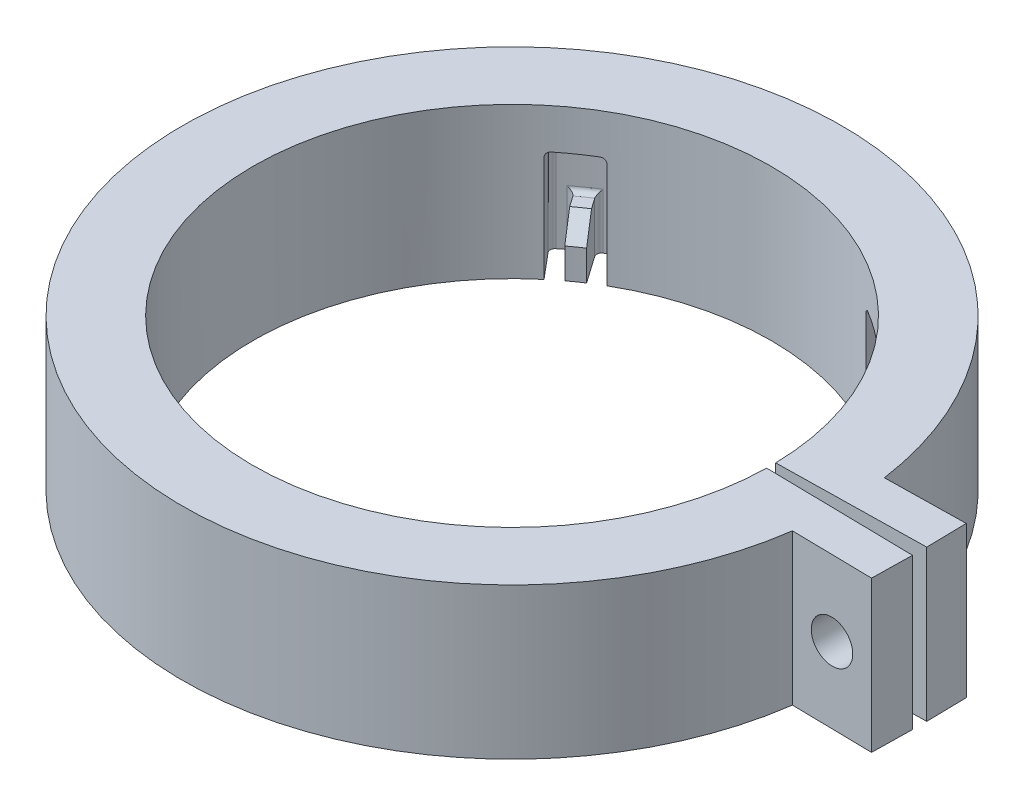
from build123d import *

# Parameters (mm, degrees)
BOSS_EXTRUDE1_DEPTH = 7.5
SKETCH2_R           = 1.05
CUT_EXTRUDE1_DEPTH  = 2
SKETCH3_R           = 1.05
CUT_EXTRUDE2_DEPTH  = 2
SKETCH4_W           = 5.25
SKETCH4_H           = 0.5
CUT_EXTRUDE3_DEPTH  = 5.5
BOSS_EXTRUDE2_DEPTH = 2.5
FILLET1_R           = 0.25
CHAMFER1_SIZE       = 1


with BuildPart() as part:
    # Sketch1 → Boss-Extrude1 (new body)
    with BuildSketch(Plane(origin=(0, 0, 0), x_dir=(1, 0, 0), z_dir=(0, 1, 0))):
        with BuildLine():
            Line((16.215023536, 2.283338945), (20.214414316, 2.35314857))
            Line((20.214414316, 2.35314857), (20.249319129, 0.35345318))
            Line((20.249319129, 0.35345318), (16.372506008, 0.285783155))
            Line((16.372506008, 0.285783155), (12.873039075, 0.224699733))
            ThreePointArc((12.873039075, 0.224699733), (-12.875, 0), (12.873039075, -0.224699733))
            Line((12.873039075, -0.224699733), (16.372506008, -0.285783155))
            Line((16.372506008, -0.285783155), (20.249319129, -0.35345318))
            Line((20.249319129, -0.35345318), (20.214414316, -2.35314857))
            Line((20.214414316, -2.35314857), (16.215023536, -2.283338945))
            ThreePointArc((16.215023536, -2.283338945), (-16.375, 0), (16.215023536, 2.283338945))
        make_face()
    extrude(amount=BOSS_EXTRUDE1_DEPTH)

    # Sketch2 → Cut-Extrude1 (cut)
    with BuildSketch(Plane(origin=(-0.034904813, 0, 1.99969539), x_dir=(0.9998476951563915, 0, 0.01745240643727699), z_dir=(-0.01745240643727699, 0, 0.9998476951563915))):
        with Locations((18.252403668, 3.75)):
            Circle(SKETCH2_R)
    extrude(amount=-CUT_EXTRUDE1_DEPTH, mode=Mode.SUBTRACT)

    # Sketch3 → Cut-Extrude2 (cut)
    with BuildSketch(Plane(origin=(-0.034904813, 0, -1.99969539), x_dir=(-0.9998476951563915, 0, 0.01745240643727699), z_dir=(-0.01745240643727699, 0, -0.9998476951563915))):
        with Locations((-18.252403668, 3.75)):
            Circle(SKETCH3_R)
    extrude(amount=-CUT_EXTRUDE2_DEPTH, mode=Mode.SUBTRACT)

    # Sketch4 → Cut-Extrude3 (cut)
    with BuildSketch(Plane.XZ):
        with BuildLine():
            Line((-8.275890475, -9.862822205), (-9.497186933, -11.318306647))
            ThreePointArc((-9.497186933, -11.318306647), (-8.474591847, -12.102971454), (-7.3875, -12.795525341))
            Line((-7.3875, -12.795525341), (-6.4375, -11.150077074))
            ThreePointArc((-6.4375, -11.150077074), (-7.384796618, -10.54658257), (-8.275890475, -9.862822205))
        make_face()
        with BuildLine():
            Line((8.275890475, -9.862822205), (9.497186933, -11.318306647))
            ThreePointArc((9.497186933, -11.318306647), (8.474591847, -12.102971454), (7.3875, -12.795525341))
            Line((7.3875, -12.795525341), (6.4375, -11.150077074))
            ThreePointArc((6.4375, -11.150077074), (7.384796618, -10.54658257), (8.275890475, -9.862822205))
        make_face()
        with Locations((0, 12.854562666)):
            Rectangle(SKETCH4_W, SKETCH4_H)
    extrude(amount=-CUT_EXTRUDE3_DEPTH, mode=Mode.SUBTRACT)

    # Sketch5 → Boss-Extrude2 (add)
    with BuildSketch(Plane.XZ):
        with BuildLine():
            Line((8.152855692, -12.321995336), (7.062626355, -10.764986482))
            ThreePointArc((7.062626355, -10.764986482), (7.384796618, -10.54658257), (7.700217882, -10.318540089))
            Line((7.700217882, -10.318540089), (8.790447219, -11.875548943))
            ThreePointArc((8.790447219, -11.875548943), (8.474591847, -12.102971454), (8.152855692, -12.321995336))
        make_face()
        with BuildLine():
            Line((-8.790447219, -11.875548943), (-7.700217882, -10.318540089))
            ThreePointArc((-7.700217882, -10.318540089), (-7.384796618, -10.54658257), (-7.062626355, -10.764986482))
            Line((-7.062626355, -10.764986482), (-8.152855692, -12.321995336))
            ThreePointArc((-8.152855692, -12.321995336), (-8.474591847, -12.102971454), (-8.790447219, -11.875548943))
        make_face()
    extrude(amount=-BOSS_EXTRUDE2_DEPTH)

    # Fillet1
    # the kernel refuses this fillet: 0.25 mm, written as the material it adds along each edge
    with BuildSketch(Plane(origin=(0, 2.5, 0), x_dir=(0.62841176473142, 0, -0.777880873879248), z_dir=(0.777880873879248, 0, 0.62841176473142))) as fillet1_piece_1_section:
        with BuildLine():
            CenterArc((14.775 - FILLET1_R, FILLET1_R), FILLET1_R, 270, 90)
            Line((14.775 - FILLET1_R, 0), (14.775, 0))
            Line((14.775, 0), (14.775, FILLET1_R))
        make_face()
    fillet1_piece_1 = revolve(axis=Axis((0, 2.5, 0), (0, 1, 0)), revolution_arc=7.866084762, mode=Mode.PRIVATE)
    fillet1_piece_1 = split(fillet1_piece_1, bisect_by=Plane(origin=(8.759939705, 2.55659864, -11.831979697), z_dir=(-0.8191520442889932, 0, -0.573576436351044)), keep=Keep.TOP, mode=Mode.PRIVATE)
    fillet1_piece_1 = split(fillet1_piece_1, bisect_by=Plane(origin=(8.122348177, 2.55659864, -12.278426091), z_dir=(0.8191520442889957, 0, 0.5735764363510407)), keep=Keep.TOP, mode=Mode.PRIVATE)
    add(fillet1_piece_1)
    with BuildSketch(Plane(origin=(8.790447219, 0, -11.875548943), x_dir=(0.7984700606490586, 0, 0.6020345191491006), z_dir=(0, 1, 0)), Plane(origin=(-8.152855692, 0, -12.321995336), x_dir=(0.8388202396872455, 0, -0.5444084913840267), z_dir=(0, 1, 0))) as fillet1_piece_2:
        with BuildLine():
            CenterArc((0.258953447, -0.249990236), FILLET1_R, 89.493613217, 92.522135515)
            Line((0.009108148, -0.258783785), (0, 0))
            ThreePointArc((0, 0), (0.130581474, 0.000577051), (0.261162947, 0))
        make_face()
    extrude(amount=2.5)
    with BuildSketch(Plane(origin=(8.152855692, 0, -12.321995336), x_dir=(-0.8388202396872467, 0, -0.5444084913840251), z_dir=(0, 1, 0)), Plane(origin=(-8.790447219, 0, -11.875548943), x_dir=(-0.7984700606490618, 0, 0.6020345191490962), z_dir=(0, 1, 0))) as fillet1_piece_3:
        with BuildLine():
            CenterArc((0.258953447, 0.249990236), FILLET1_R, 177.984251268, 92.522135515)
            Line((0.009108148, 0.258783785), (0, 0))
            ThreePointArc((0, 0), (0.130581474, -0.000577051), (0.261162947, 0))
        make_face()
    extrude(amount=2.5)
    with BuildSketch(Plane(origin=(-2.625, 5.5, 11.979562666), x_dir=(0, -1, 0), z_dir=(0, 0, 1))) as fillet1_piece_4_section:
        with BuildLine():
            CenterArc((FILLET1_R, FILLET1_R), FILLET1_R, 180, 90)
            Line((0, FILLET1_R), (0, 0))
            Line((0, 0), (FILLET1_R, 0))
        make_face()
    fillet1_piece_4 = extrude(amount=1.75, mode=Mode.PRIVATE)
    fillet1_piece_4 = fillet1_piece_4 - Plane(origin=(0, 5.442690928, 0), x_dir=(0.9998476951563914, 0, -0.01745240643727672), z_dir=(0, -1, 0)) * Cylinder(12.875, 5, mode=Mode.PRIVATE)
    add(fillet1_piece_4)
    with BuildSketch(Plane(origin=(-2.625, 0, 13.104562666), x_dir=(1, 0, 0), z_dir=(0, 1, 0)), Plane(origin=(2.625, 0, 13.104562666), x_dir=(0, 0, -1), z_dir=(0, 1, 0))) as fillet1_piece_5:
        with BuildLine():
            CenterArc((FILLET1_R, FILLET1_R), FILLET1_R, 180, 90)
            Line((0, FILLET1_R), (0, 0))
            Line((0, 0), (FILLET1_R, 0))
        make_face()
    extrude(amount=6.125)
    with BuildSketch(Plane(origin=(2.625, 5.5, 13.729562666), x_dir=(0, -1, 0), z_dir=(0, 0, -1))) as fillet1_piece_6_section:
        with BuildLine():
            CenterArc((FILLET1_R, FILLET1_R), FILLET1_R, 180, 90)
            Line((0, FILLET1_R), (0, 0))
            Line((0, 0), (FILLET1_R, 0))
        make_face()
    fillet1_piece_6 = extrude(amount=1.75, mode=Mode.PRIVATE)
    fillet1_piece_6 = fillet1_piece_6 - Plane(origin=(0, 5.443401221, 0), x_dir=(0.9998476951563914, 0, -0.01745240643727672), z_dir=(0, -1, 0)) * Cylinder(12.875, 5, mode=Mode.PRIVATE)
    add(fillet1_piece_6)
    with BuildSketch(Plane(origin=(-7.7, 5.5, -13.336791218), x_dir=(0, -1, 0), z_dir=(0.4999999999999989, 0, 0.8660254037844394))) as fillet1_piece_7_section:
        with BuildLine():
            CenterArc((FILLET1_R, -FILLET1_R), FILLET1_R, 90, 90)
            Line((0, -FILLET1_R), (0, 0))
            Line((0, 0), (FILLET1_R, 0))
        make_face()
    fillet1_piece_7 = extrude(amount=3.15, mode=Mode.PRIVATE)
    fillet1_piece_7 = fillet1_piece_7 - Plane(origin=(0, 5.443414893, 0), x_dir=(0.9998476951563914, 0, -0.01745240643727672), z_dir=(0, -1, 0)) * Cylinder(12.875, 8, mode=Mode.PRIVATE)
    add(fillet1_piece_7)
    with BuildSketch(Plane(origin=(-7.3875, 0, -12.795525341), x_dir=(-0.8616902462472484, 0, 0.5074346455676397), z_dir=(0, 1, 0)), Plane(origin=(9.497186933, 0, -11.318306647), x_dir=(-0.7715480134948484, 0, -0.6361710955962662), z_dir=(0, 1, 0))) as fillet1_piece_8:
        with BuildLine():
            CenterArc((0.252160801, 0.249990742), FILLET1_R, 179.506896654, 90.986206692)
            Line((0.00217006, 0.252142284), (0, 0))
            ThreePointArc((0, 0), (0.127156172, -0.000547174), (0.254312344, 0))
        make_face()
    extrude(amount=6.13578086)
    with BuildSketch(Plane(origin=(-7.874148219, 5.5, -9.384044428), x_dir=(0, -1, 0), z_dir=(-0.6427876096865357, 0, -0.7660444431189812))) as fillet1_piece_9_section:
        with BuildLine():
            CenterArc((FILLET1_R, -FILLET1_R), FILLET1_R, 90, 90)
            Line((0, -FILLET1_R), (0, 0))
            Line((0, 0), (FILLET1_R, 0))
        make_face()
    fillet1_piece_9 = extrude(amount=3.15, mode=Mode.PRIVATE)
    fillet1_piece_9 = fillet1_piece_9 - Plane(origin=(0, 5.443401887, 0), x_dir=(0.9998476951563914, 0, -0.01745240643727672), z_dir=(0, -1, 0)) * Cylinder(12.875, 8, mode=Mode.PRIVATE)
    add(fillet1_piece_9)
    with BuildSketch(Plane(origin=(-9.497186933, 0, -11.318306647), x_dir=(0.6427876096865356, 0, 0.7660444431189811), z_dir=(0, 1, 0)), Plane(origin=(7.3875, 0, -12.795525341), x_dir=(-0.499999999999998, 0, 0.8660254037844396), z_dir=(0, 1, 0))) as fillet1_piece_10:
        with BuildLine():
            CenterArc((0.252151622, 0.25), FILLET1_R, 179.013793308, 90.986206692)
            ThreePointArc((0.002188655, 0.254302926), (0.000547174, 0.127156172), (0, 0))
            Line((0, 0), (0.252151622, 0))
        make_face()
    extrude(amount=6.13578086)
    with BuildSketch(Plane(origin=(7.874148219, 5.5, -9.384044428), x_dir=(0, -1, 0), z_dir=(0.6427876096865357, 0, -0.7660444431189812))) as fillet1_piece_11_section:
        with BuildLine():
            CenterArc((FILLET1_R, FILLET1_R), FILLET1_R, 180, 90)
            Line((0, FILLET1_R), (0, 0))
            Line((0, 0), (FILLET1_R, 0))
        make_face()
    fillet1_piece_11 = extrude(amount=3.15, mode=Mode.PRIVATE)
    fillet1_piece_11 = fillet1_piece_11 - Plane(origin=(0, 5.443401886, 0), x_dir=(0.9998476951563914, 0, -0.01745240643727672), z_dir=(0, -1, 0)) * Cylinder(12.875, 8, mode=Mode.PRIVATE)
    add(fillet1_piece_11)
    with BuildSketch(Plane(origin=(7.7, 5.5, -13.336791218), x_dir=(0, -1, 0), z_dir=(-0.4999999999999989, 0, 0.8660254037844394))) as fillet1_piece_12_section:
        with BuildLine():
            CenterArc((FILLET1_R, FILLET1_R), FILLET1_R, 180, 90)
            Line((0, FILLET1_R), (0, 0))
            Line((0, 0), (FILLET1_R, 0))
        make_face()
    fillet1_piece_12 = extrude(amount=3.15, mode=Mode.PRIVATE)
    fillet1_piece_12 = fillet1_piece_12 - Plane(origin=(0, 5.443414893, 0), x_dir=(0.9998476951563914, 0, -0.01745240643727672), z_dir=(0, -1, 0)) * Cylinder(12.875, 8, mode=Mode.PRIVATE)
    add(fillet1_piece_12)
    with BuildSketch(Plane(origin=(0, 2.5, 0), x_dir=(-0.5160394351938659, 0, -0.856564826107631), z_dir=(0.856564826107631, 0, -0.5160394351938659))) as fillet1_piece_13_section:
        with BuildLine():
            CenterArc((14.775 - FILLET1_R, FILLET1_R), FILLET1_R, 270, 90)
            Line((14.775 - FILLET1_R, 0), (14.775, 0))
            Line((14.775, 0), (14.775, FILLET1_R))
        make_face()
    fillet1_piece_13 = revolve(axis=Axis((0, 2.5, 0), (0, 1, 0)), revolution_arc=7.866084762, mode=Mode.PRIVATE)
    fillet1_piece_13 = split(fillet1_piece_13, bisect_by=Plane(origin=(-8.759939705, 2.55659864, -11.831979697), z_dir=(0.8191520442889937, 0, -0.5735764363510434)), keep=Keep.TOP, mode=Mode.PRIVATE)
    fillet1_piece_13 = split(fillet1_piece_13, bisect_by=Plane(origin=(-8.122348177, 2.55659864, -12.278426091), z_dir=(-0.8191520442889957, 0, 0.5735764363510407)), keep=Keep.TOP, mode=Mode.PRIVATE)
    add(fillet1_piece_13)
    with BuildSketch(Plane(origin=(8.790447219, 0, -11.875548943), x_dir=(0.7984700606490586, 0, 0.6020345191491006), z_dir=(0, 1, 0))) as fillet1_piece_14a_section:
        with BuildLine():
            CenterArc((0.258953447, -0.249990236), FILLET1_R, 89.493613217, 92.522135515)
            Line((0.009108148, -0.258783785), (0, 0))
            ThreePointArc((0, 0), (0.130581474, 0.000577051), (0.261162947, 0))
        make_face()
    fillet1_piece_14a = extrude(amount=3.152907368, mode=Mode.PRIVATE)
    fillet1_piece_14a = split(fillet1_piece_14a, bisect_by=Plane(origin=(8.804363414, 2.5, -11.791834309), z_dir=(0, 1, 0)), keep=Keep.TOP, mode=Mode.PRIVATE)
    with BuildSketch(Plane(origin=(0, 2.5, 0), x_dir=(0.62841176473142, 0, -0.777880873879248), z_dir=(0.777880873879248, 0, 0.62841176473142))) as fillet1_piece_14b_section:
        with BuildLine():
            CenterArc((14.775 - FILLET1_R, FILLET1_R), FILLET1_R, 270, 90)
            Line((14.775 - FILLET1_R, 0), (14.775, 0))
            Line((14.775, 0), (14.775, FILLET1_R))
        make_face()
    fillet1_piece_14b = revolve(axis=Axis((0, 2.5, 0), (0, 1, 0)), revolution_arc=7.866084762, mode=Mode.PRIVATE)
    fillet1_piece_14b = split(fillet1_piece_14b, bisect_by=Plane(origin=(8.750942177, 2.556788389, -11.819129896), z_dir=(0.8191520442889932, 0, 0.573576436351044)), keep=Keep.TOP, mode=Mode.PRIVATE)
    fillet1_piece_14 = fillet1_piece_14a & fillet1_piece_14b
    add(fillet1_piece_14)
    with BuildSketch(Plane(origin=(0, 2.5, 0), x_dir=(0.62841176473142, 0, -0.777880873879248), z_dir=(0.777880873879248, 0, 0.62841176473142))) as fillet1_piece_15a_section:
        with BuildLine():
            CenterArc((14.775 - FILLET1_R, FILLET1_R), FILLET1_R, 270, 90)
            Line((14.775 - FILLET1_R, 0), (14.775, 0))
            Line((14.775, 0), (14.775, FILLET1_R))
        make_face()
    fillet1_piece_15a = revolve(axis=Axis((0, 2.5, 0), (0, 1, 0)), revolution_arc=7.866084762, mode=Mode.PRIVATE)
    fillet1_piece_15a = split(fillet1_piece_15a, bisect_by=Plane(origin=(8.113350762, 2.556788399, -12.26557645), z_dir=(-0.8191520442889957, 0, -0.5735764363510407)), keep=Keep.TOP, mode=Mode.PRIVATE)
    with BuildSketch(Plane(origin=(8.152855692, 0, -12.321995336), x_dir=(-0.8388202396872467, 0, -0.5444084913840251), z_dir=(0, 1, 0))) as fillet1_piece_15b_section:
        with BuildLine():
            CenterArc((0.258953447, 0.249990236), FILLET1_R, 177.984251268, 92.522135515)
            Line((0.009108148, 0.258783785), (0, 0))
            ThreePointArc((0, 0), (0.130581474, -0.000577051), (0.261162947, 0))
        make_face()
    fillet1_piece_15b = extrude(amount=3.152907368, mode=Mode.PRIVATE)
    fillet1_piece_15b = split(fillet1_piece_15b, bisect_by=Plane(origin=(8.069430049, 2.5, -12.306440191), z_dir=(0, 1, 0)), keep=Keep.TOP, mode=Mode.PRIVATE)
    fillet1_piece_15 = fillet1_piece_15a & fillet1_piece_15b
    add(fillet1_piece_15)
    with BuildSketch(Plane(origin=(0, 2.5, 0), x_dir=(-0.5160394351938659, 0, -0.856564826107631), z_dir=(0.856564826107631, 0, -0.5160394351938659))) as fillet1_piece_16a_section:
        with BuildLine():
            CenterArc((14.775 - FILLET1_R, FILLET1_R), FILLET1_R, 270, 90)
            Line((14.775 - FILLET1_R, 0), (14.775, 0))
            Line((14.775, 0), (14.775, FILLET1_R))
        make_face()
    fillet1_piece_16a = revolve(axis=Axis((0, 2.5, 0), (0, 1, 0)), revolution_arc=7.866084762, mode=Mode.PRIVATE)
    fillet1_piece_16a = split(fillet1_piece_16a, bisect_by=Plane(origin=(-8.11335065, 2.556788389, -12.26557629), z_dir=(0.8191520442889957, 0, -0.5735764363510407)), keep=Keep.TOP, mode=Mode.PRIVATE)
    with BuildSketch(Plane(origin=(-8.152855692, 0, -12.321995336), x_dir=(0.8388202396872455, 0, -0.5444084913840267), z_dir=(0, 1, 0))) as fillet1_piece_16b_section:
        with BuildLine():
            CenterArc((0.258953447, -0.249990236), FILLET1_R, 89.493613217, 92.522135515)
            Line((0.009108148, -0.258783785), (0, 0))
            ThreePointArc((0, 0), (0.130581474, 0.000577051), (0.261162947, 0))
        make_face()
    fillet1_piece_16b = extrude(amount=3.152907368, mode=Mode.PRIVATE)
    fillet1_piece_16b = split(fillet1_piece_16b, bisect_by=Plane(origin=(-8.069430049, 2.5, -12.306440191), z_dir=(0, 1, 0)), keep=Keep.TOP, mode=Mode.PRIVATE)
    fillet1_piece_16 = fillet1_piece_16a & fillet1_piece_16b
    add(fillet1_piece_16)
    with BuildSketch(Plane(origin=(-8.790447219, 0, -11.875548943), x_dir=(-0.7984700606490618, 0, 0.6020345191490962), z_dir=(0, 1, 0))) as fillet1_piece_17a_section:
        with BuildLine():
            CenterArc((0.258953447, 0.249990236), FILLET1_R, 177.984251268, 92.522135515)
            Line((0.009108148, 0.258783785), (0, 0))
            ThreePointArc((0, 0), (0.130581474, -0.000577051), (0.261162947, 0))
        make_face()
    fillet1_piece_17a = extrude(amount=3.152907368, mode=Mode.PRIVATE)
    fillet1_piece_17a = split(fillet1_piece_17a, bisect_by=Plane(origin=(-8.804363414, 2.5, -11.791834309), z_dir=(0, 1, 0)), keep=Keep.TOP, mode=Mode.PRIVATE)
    with BuildSketch(Plane(origin=(0, 2.5, 0), x_dir=(-0.5160394351938659, 0, -0.856564826107631), z_dir=(0.856564826107631, 0, -0.5160394351938659))) as fillet1_piece_17b_section:
        with BuildLine():
            CenterArc((14.775 - FILLET1_R, FILLET1_R), FILLET1_R, 270, 90)
            Line((14.775 - FILLET1_R, 0), (14.775, 0))
            Line((14.775, 0), (14.775, FILLET1_R))
        make_face()
    fillet1_piece_17b = revolve(axis=Axis((0, 2.5, 0), (0, 1, 0)), revolution_arc=7.866084762, mode=Mode.PRIVATE)
    fillet1_piece_17b = split(fillet1_piece_17b, bisect_by=Plane(origin=(-8.750942289, 2.556788399, -11.819130056), z_dir=(-0.8191520442889937, 0, 0.5735764363510434)), keep=Keep.TOP, mode=Mode.PRIVATE)
    fillet1_piece_17 = fillet1_piece_17a & fillet1_piece_17b
    add(fillet1_piece_17)

    # Chamfer1
    chamfer1_edges = [part.edges().sort_by_distance(p)[0] for p in [
        (7.384796618, 2.5, -10.54658257),
        (-7.384796618, 2.5, -10.54658257),
    ]]
    chamfer(chamfer1_edges, length=CHAMFER1_SIZE)


solid = part.part
